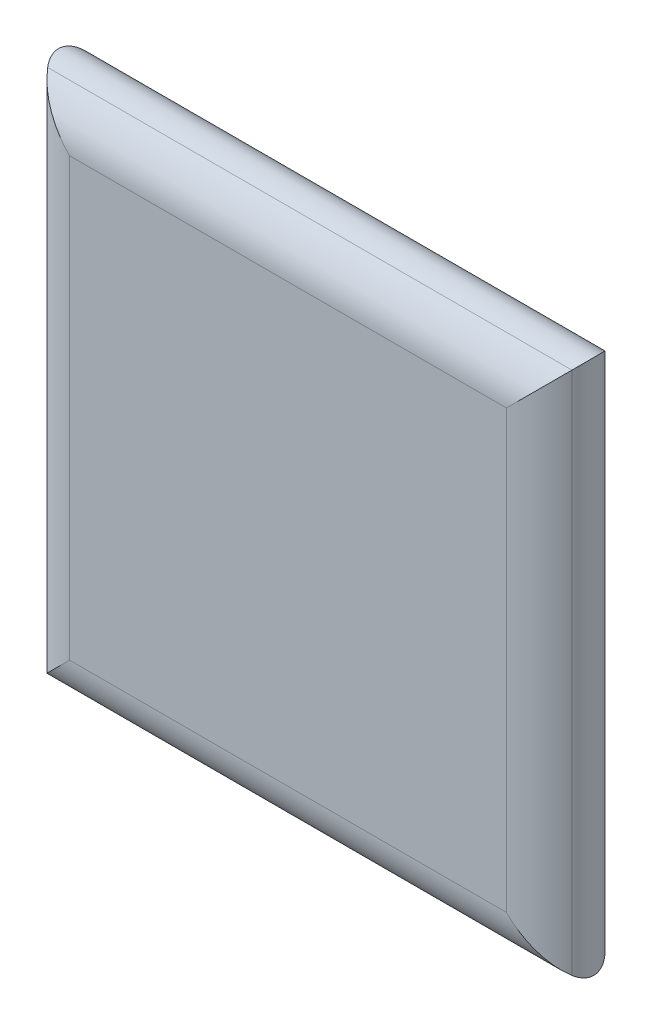
from build123d import *
from OCP.BRepAlgoAPI import BRepAlgoAPI_Cut
from OCP.TopTools import TopTools_ListOfShape

# Parameters (mm, degrees)
SKETCH1_W           = 500
SKETCH1_H           = 500
BOSS_EXTRUDE1_DEPTH = 60
FILLET3_R           = 50
FILLET4_R           = 50
FILLET6_START       = -234
FILLET6_DEPTH       = 502
FILLET6_2_DEPTH     = 492


with BuildPart() as part:
    # Sketch1 → Boss-Extrude1 (new body)
    with BuildSketch(Plane.XY):
        with Locations((11.616161616, 16.666666667)):
            Rectangle(SKETCH1_W, SKETCH1_H)
    extrude(amount=BOSS_EXTRUDE1_DEPTH)

    # Fillet3
    fillet3_edges = [part.edges().sort_by_distance(p)[0] for p in [
        (11.616161616, -233.333333333, 60),
        (261.616161616, 16.666666667, 60),
        (11.616161616, 266.666666667, 60),
        (-238.383838384, 16.666666667, 60),
    ]]
    fillet(fillet3_edges, radius=FILLET3_R)

    # Fillet4
    # the kernel refuses this fillet: 50 mm, written as the material it takes off along each edge
    with BuildSketch(Plane(origin=(-238.383838384, 341.666666667, 0), x_dir=(0, 0, 1), z_dir=(0, -1, 0)), Plane(origin=(336.616161616, 266.666666667, 0), x_dir=(0, 0, 1), z_dir=(-1, 0, 0))) as fillet4_piece_1:
        with BuildLine():
            CenterArc((50, -30), FILLET4_R, 143.130102354, 36.869897646)
            Line((0, -30), (-1, -30))
            Line((-1, -30), (-1, 0))
            Line((-1, 0), (0, 1))
            ThreePointArc((0, 1), (5, 1), (9.2, 0.6))
            Line((9.2, 0.6), (10, 0))
        make_face()
    extrude(amount=650, mode=Mode.SUBTRACT)
    with BuildSketch(Plane(origin=(-313.383838384, -233.333333333, 0), x_dir=(0, 1, 0), z_dir=(1, 0, 0)), Plane(origin=(261.616161616, -308.333333333, 0), x_dir=(-1, 0, 0), z_dir=(0, 1, 0))) as fillet4_piece_2:
        with BuildLine():
            CenterArc((30, 50), FILLET4_R, 233.130102354, 36.869897646)
            Line((0, 10), (-0.6, 9.2))
            ThreePointArc((-0.6, 9.2), (-1, 5), (-1, 0))
            Line((-1, 0), (0, -1))
            Line((0, -1), (30, -1))
            Line((30, -1), (30, 0))
        make_face()
    extrude(amount=650, mode=Mode.SUBTRACT)


with BuildPart() as fillet6_tool:
    # Fillet6: read off the stored shape, not the designer's step
    # Fillet6 outline → Fillet6 (new body)
    with BuildSketch(Plane(origin=(0, 0, 0), x_dir=(1, 0, 0), z_dir=(0, 1, 0)).offset(FILLET6_START)):
        with BuildLine():
            ThreePointArc((261.616161616, -10), (247.427549917, -2.565835097), (231.616161616, 0))
            ThreePointArc((231.616161616, 0), (253.976841391, -13.819660113), (251.616161616, -40))
            ThreePointArc((251.616161616, -40), (259.050326518, -25.811388301), (261.616161616, -10))
        make_face()
        with BuildLine():
            ThreePointArc((-228.383838384, -40), (-230.744518159, -13.819660113), (-208.383838384, 0))
            ThreePointArc((-208.383838384, 0), (-224.195226685, -2.565835097), (-238.383838384, -10))
            ThreePointArc((-238.383838384, -10), (-235.818003286, -25.811388301), (-228.383838384, -40))
        make_face()
    extrude(amount=FILLET6_DEPTH)


with BuildPart() as part_1:
    add(part.part)

    # Fillet6: cut by fillet6_tool, with a tolerance
    fillet6_stock = TopTools_ListOfShape()
    fillet6_stock.Append(part_1.part.wrapped)
    fillet6_tools = TopTools_ListOfShape()
    fillet6_tools.Append(fillet6_tool.part.wrapped)
    fillet6_cut = BRepAlgoAPI_Cut()
    fillet6_cut.SetArguments(fillet6_stock)
    fillet6_cut.SetTools(fillet6_tools)
    fillet6_cut.SetFuzzyValue(0.00001)
    fillet6_cut.Build()
    add(Compound.cast(fillet6_cut.Shape()).solids(), mode=Mode.REPLACE)


with BuildPart() as fillet6_2_tool:
    # Fillet6 2 outline → Fillet6 2 (new body)
    with BuildSketch(Plane.YZ.offset(FILLET6_START)):
        with BuildLine():
            ThreePointArc((-233.333333333, 10), (-219.144721634, 2.565835097), (-203.333333333, 0))
            ThreePointArc((-203.333333333, 0), (-225.694013108, 13.819660113), (-223.333333333, 40))
            ThreePointArc((-223.333333333, 40), (-230.767498236, 25.811388301), (-233.333333333, 10))
        make_face()
        with BuildLine():
            ThreePointArc((256.666666667, 40), (259.027346442, 13.819660113), (236.666666667, 0))
            ThreePointArc((236.666666667, 0), (252.478054612, 2.565834979), (266.666666667, 10))
            ThreePointArc((266.666666667, 10), (264.100831569, 25.811388301), (256.666666667, 40))
        make_face()
    extrude(amount=FILLET6_2_DEPTH)


with BuildPart() as part_2:
    add(part_1.part)

    # Fillet6 2: cut by fillet6_2_tool, with a tolerance
    fillet6_2_stock = TopTools_ListOfShape()
    fillet6_2_stock.Append(part_2.part.wrapped)
    fillet6_2_tools = TopTools_ListOfShape()
    fillet6_2_tools.Append(fillet6_2_tool.part.wrapped)
    fillet6_2_cut = BRepAlgoAPI_Cut()
    fillet6_2_cut.SetArguments(fillet6_2_stock)
    fillet6_2_cut.SetTools(fillet6_2_tools)
    fillet6_2_cut.SetFuzzyValue(0.00001)
    fillet6_2_cut.Build()
    add(Compound.cast(fillet6_2_cut.Shape()).solids(), mode=Mode.REPLACE)


solid = part_2.part
